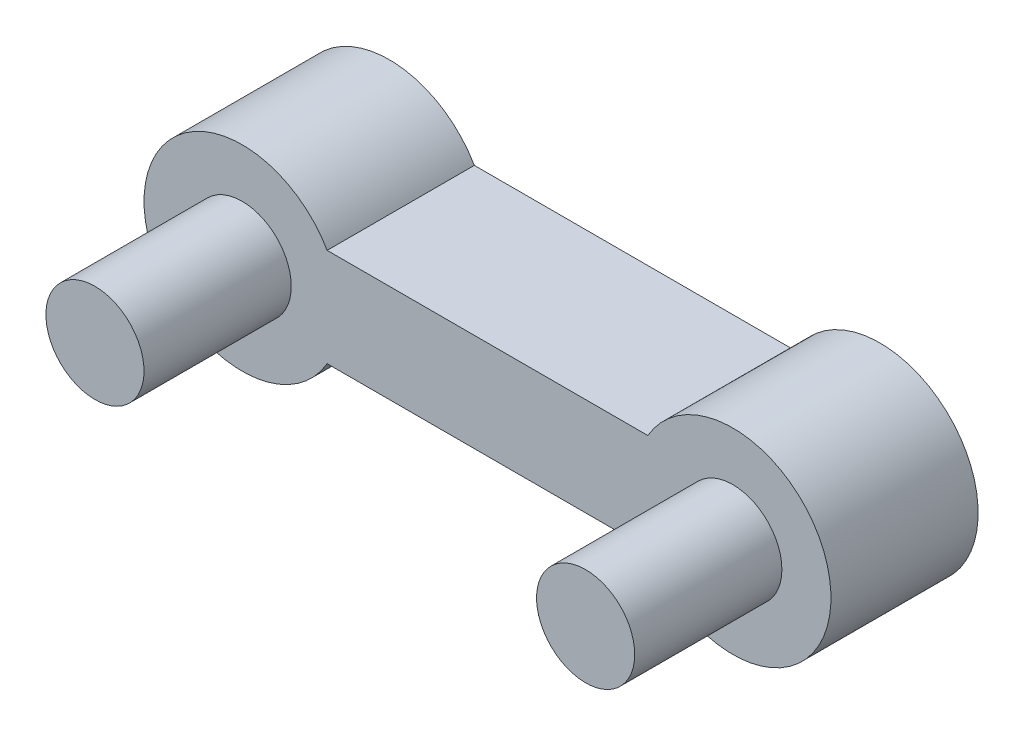
from build123d import *

# Parameters (mm, degrees)
BOSS_EXTRUDE1_DEPTH = 3
SKETCH3_R           = 1
BOSS_EXTRUDE2_DEPTH = 3


with BuildPart() as part:
    # Sketch2 → Boss-Extrude1 (new body)
    with BuildSketch(Plane.XY):
        with BuildLine():
            Line((-29.969106115, 13.800340042), (-36.5050045, 13.800340042))
            ThreePointArc((-36.5050045, 13.800340042), (-40.237055307, 12.800340042), (-36.5050045, 11.800340042))
            Line((-36.5050045, 11.800340042), (-29.969106115, 11.800340042))
            ThreePointArc((-29.969106115, 11.800340042), (-26.237055307, 12.800340042), (-29.969106115, 13.800340042))
        make_face()
    extrude(amount=BOSS_EXTRUDE1_DEPTH)

    # Sketch3 → Boss-Extrude2 (add)
    with BuildSketch(Plane.XY.offset(3)):
        with Locations((-38.237055307, 12.800340042)):
            Circle(SKETCH3_R)
        with Locations((-28.237055307, 12.800340042)):
            Circle(SKETCH3_R)
    extrude(amount=BOSS_EXTRUDE2_DEPTH)


solid = part.part
